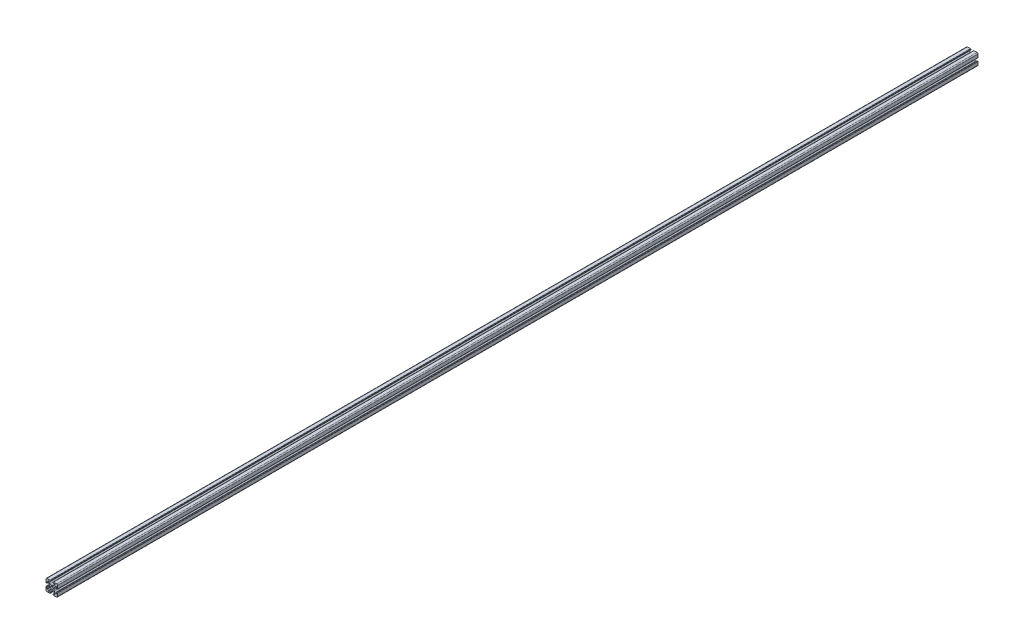
from build123d import *

# Parameters (mm, degrees)
BOSS_EXTRUDE1_DEPTH = 800


with BuildPart() as part:
    # Sketch4 → Boss-Extrude1 (new, symmetric)
    with BuildSketch(Plane.XY):
        with BuildLine():
            Line((3, -10), (8.25, -10))
            ThreePointArc((8.25, -10), (9.487436867, -9.487436867), (10, -8.25))
            Line((10, -8.25), (10, -3))
            ThreePointArc((10, -3), (9.853553391, -2.646446609), (9.5, -2.5))
            Line((9.5, -2.5), (8.424621202, -2.5))
            ThreePointArc((8.424621202, -2.5), (8.071067812, -2.646446609), (7.924621202, -3))
            Line((7.924621202, -3), (7.924621202, -5.25))
            ThreePointArc((7.924621202, -5.25), (7.615962919, -5.711939766), (7.071067812, -5.603553391))
            Line((7.071067812, -5.603553391), (4.478679656, -3.011165235))
            ThreePointArc((4.478679656, -3.011165235), (3.828361402, -2.037895189), (3.6, -0.889844892))
            Line((3.6, -0.889844892), (3.6, 0))
            Line((3.6, 0), (2.15, 0))
            ThreePointArc((2.15, 0), (1.52027958, -1.52027958), (0, -2.15))
            Line((0, -2.15), (0, -3.6))
            Line((0, -3.6), (0.889844892, -3.6))
            ThreePointArc((0.889844892, -3.6), (2.037895189, -3.828361402), (3.011165235, -4.478679656))
            Line((3.011165235, -4.478679656), (5.603553391, -7.071067812))
            ThreePointArc((5.603553391, -7.071067812), (5.711939766, -7.615962919), (5.25, -7.924621202))
            Line((5.25, -7.924621202), (3, -7.924621202))
            ThreePointArc((3, -7.924621202), (2.646446609, -8.071067812), (2.5, -8.424621202))
            Line((2.5, -8.424621202), (2.5, -9.5))
            ThreePointArc((2.5, -9.5), (2.646446609, -9.853553391), (3, -10))
        make_face()
    extrude(amount=BOSS_EXTRUDE1_DEPTH, both=True)

    # Mirror1: part across plane


with BuildPart() as part_1:
    add(part.part)
    add(part.part.mirror(Plane(origin=(0, 0, 0), x_dir=(0, 0, 1), z_dir=(1, 0, 0))))

    # Mirror2: part across plane


with BuildPart() as part_2:
    add(part_1.part)
    add(part_1.part.mirror(Plane.ZX))


solid = part_2.part
